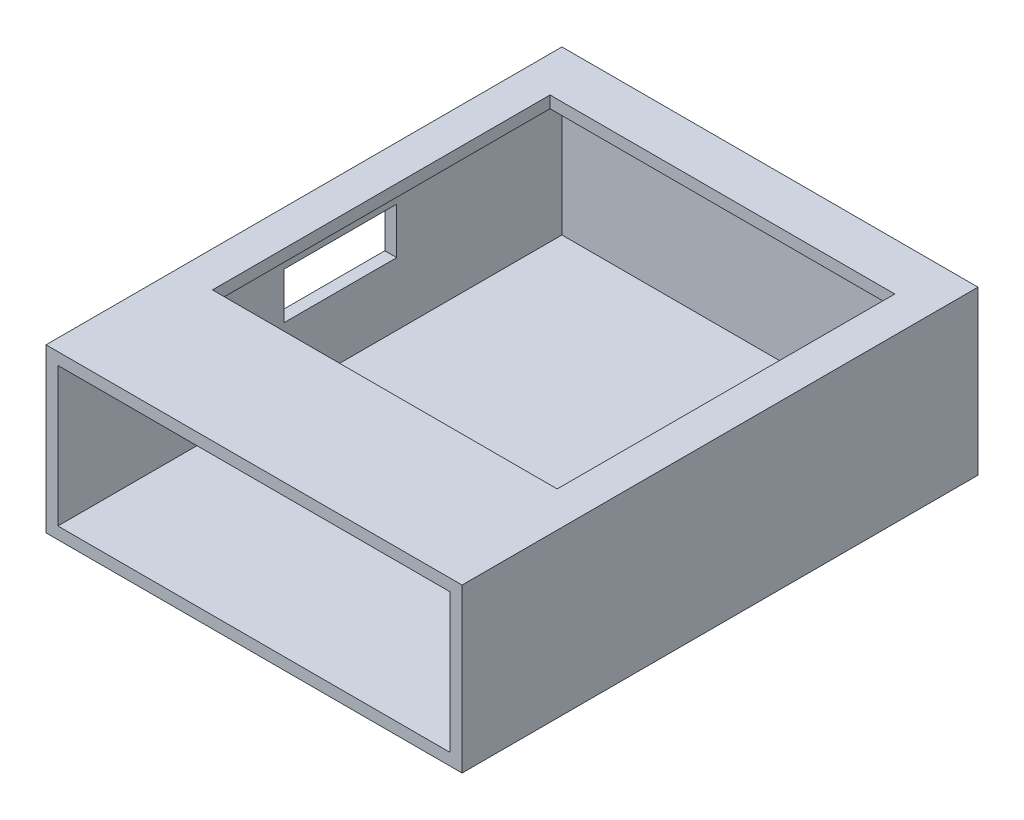
from build123d import *

# Parameters (mm, degrees)
SKETCH_1_W            = 33
SKETCH_1_H            = 42.4
EXTRUDE_1_DEPTH       = 11.7
SHELL_1_T             = 1
CUT_EXTRUDE_668_REACH = 58.969
SKETCH_2_W            = 9.5
SKETCH_2_H            = 3.9
SKETCH_4_W            = 35
SKETCH_4_H            = 43.4
SKETCH_4_W_2          = 29
SKETCH_4_H_2          = 28.4
EXTRUDE_2_DEPTH       = 1


with BuildPart() as part:
    # 草图1 → 凸台-拉伸1 (new body)
    with BuildSketch(Plane(origin=(0, 0, 0), x_dir=(1, 0, 0), z_dir=(0, 1, 0))):
        with Locations((16.5, 21.2)):
            Rectangle(SKETCH_1_W, SKETCH_1_H)
    extrude(amount=EXTRUDE_1_DEPTH)

    # 抽壳1
    shell_1_openings = [part.faces().sort_by_distance(p)[0] for p in [
        (16.5, 11.7, -21.2),
        (16.5, 5.85, 0),
    ]]
    offset(amount=SHELL_1_T, openings=shell_1_openings, kind=Kind.INTERSECTION)

    # 草图2 → Cut-Extrude 668 (cut, up to next)
    with BuildSketch(Plane.ZY.offset(1), mode=Mode.PRIVATE) as cut_extrude_668_sk1:
        with Locations((-23.75, 7.25)):
            Rectangle(SKETCH_2_W, SKETCH_2_H)
    cut_extrude_668_tool1 = extrude(cut_extrude_668_sk1.sketch, amount=-CUT_EXTRUDE_668_REACH, mode=Mode.PRIVATE) & part.part
    # 草图2 → Cut-Extrude 668 (cut, up to next)
    with BuildSketch(Plane.ZY.offset(1), mode=Mode.PRIVATE) as cut_extrude_668_sk2:
        Polygon((-11.25, 8.3), (-9.65, 8.3), (-9.65, 6.1), (-12.85, 6.1), (-12.85, 8.3), align=None)
    cut_extrude_668_tool2 = extrude(cut_extrude_668_sk2.sketch, amount=-CUT_EXTRUDE_668_REACH, mode=Mode.PRIVATE) & part.part
    add(cut_extrude_668_tool1.solids().sort_by_distance((-1, 7.25, -23.75))[0], mode=Mode.SUBTRACT)
    add(cut_extrude_668_tool2.solids().sort_by_distance((-1, 7.2, -11.25))[0], mode=Mode.SUBTRACT)

    # 草图4 → 凸台-拉伸2 (add)
    with BuildSketch(Plane(origin=(0, 11.7, 0), x_dir=(1, 0, 0), z_dir=(0, 1, 0))):
        with Locations((16.5, 21.7)):
            Rectangle(SKETCH_4_W, SKETCH_4_H)
        with Locations((16.5, 25.2)):
            Rectangle(SKETCH_4_W_2, SKETCH_4_H_2, mode=Mode.SUBTRACT)
    extrude(amount=EXTRUDE_2_DEPTH)


solid = part.part
